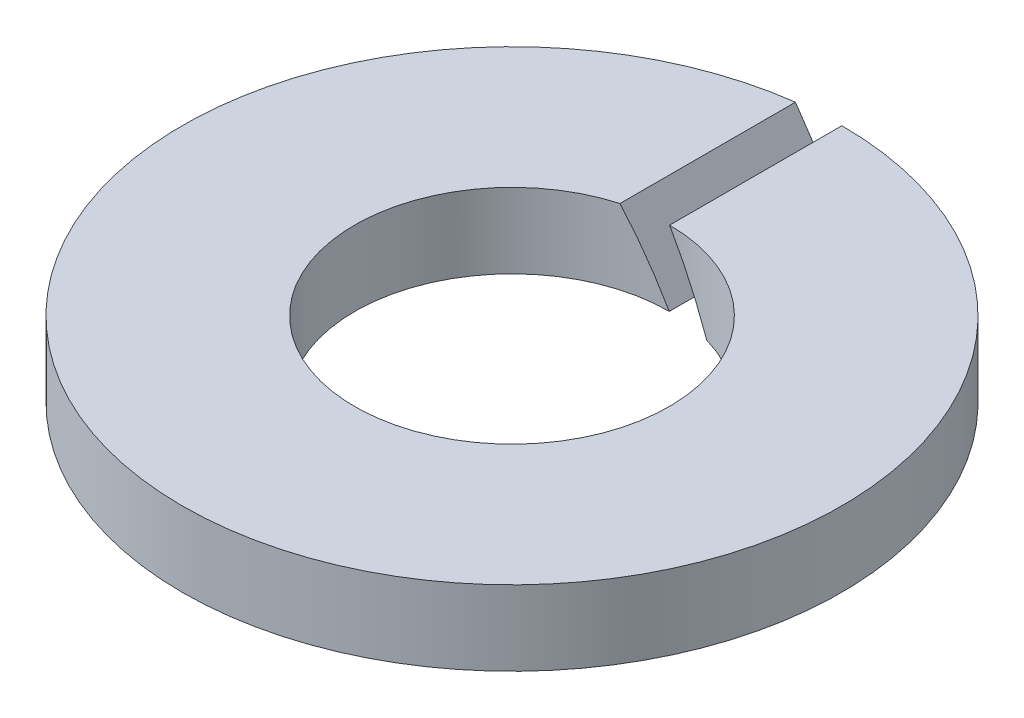
from build123d import *

# Parameters (mm, degrees)
BOSESKE_R      = 2.2
BOSESKE_R_2    = 1.05
BASEBODY_DEPTH = 0.5
SLIT_DEPTH     = 4.151190251


with BuildPart() as part:
    # BoseSke → BaseBody (new body)
    with BuildSketch(Plane(origin=(0, 0, 0), x_dir=(1, 0, 0), z_dir=(0, 1, 0))):
        Circle(BOSESKE_R)
        Circle(BOSESKE_R_2, mode=Mode.SUBTRACT)
    extrude(amount=BASEBODY_DEPTH)

    # SlitSke → Slit (cut, through all)
    with BuildSketch(Plane.XY):
        Polygon((0, 0), (-0.288675135, 0.5), (0.002309401, 0.5), (0.290984536, 0), align=None)
    extrude(amount=-SLIT_DEPTH, mode=Mode.SUBTRACT)


solid = part.part
